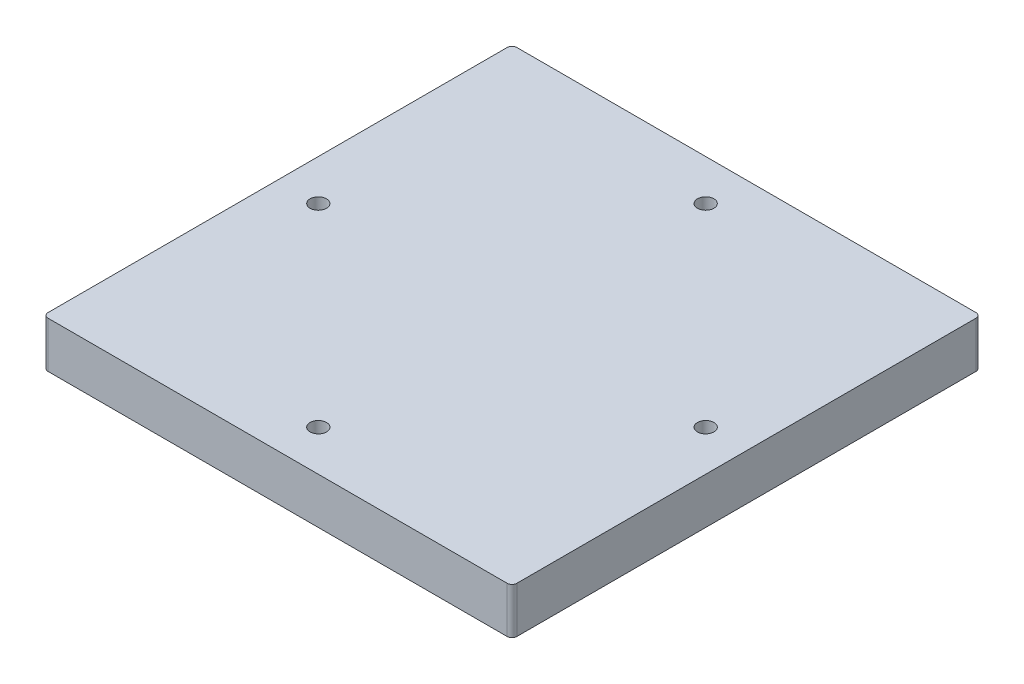
from build123d import *

# Parameters (mm, degrees)
SKETCH1_W            = 96.825
SKETCH1_H            = 96.825
BOSS_EXTRUDE1_DEPTH  = 4.7625
FILLET1_R            = 1
M3_CLEARANCE_HOLE1_D = 3.4


with BuildPart() as part:
    # Sketch1 → Boss-Extrude1 (new, symmetric)
    with BuildSketch(Plane(origin=(0, 0, 0), x_dir=(1, 0, 0), z_dir=(0, 1, 0))):
        Rectangle(SKETCH1_W, SKETCH1_H)
    extrude(amount=BOSS_EXTRUDE1_DEPTH, both=True)

    # Fillet1
    fillet1_edges = [part.edges().sort_by_distance(p)[0] for p in [
        (-48.4125, 0, -48.4125),
        (48.4125, 0, -48.4125),
        (48.4125, 0, 48.4125),
        (-48.4125, 0, 48.4125),
    ]]
    fillet(fillet1_edges, radius=FILLET1_R)

    # M3 Clearance Hole1 (through all)
    with Locations(Plane(origin=(0, 4.7625, 0), x_dir=(1, 0, 0), z_dir=(0, 1, 0))):
        with Locations((-40, 0), (0, 40), (40, 0), (0, -40)):
            Hole(M3_CLEARANCE_HOLE1_D / 2)


solid = part.part
